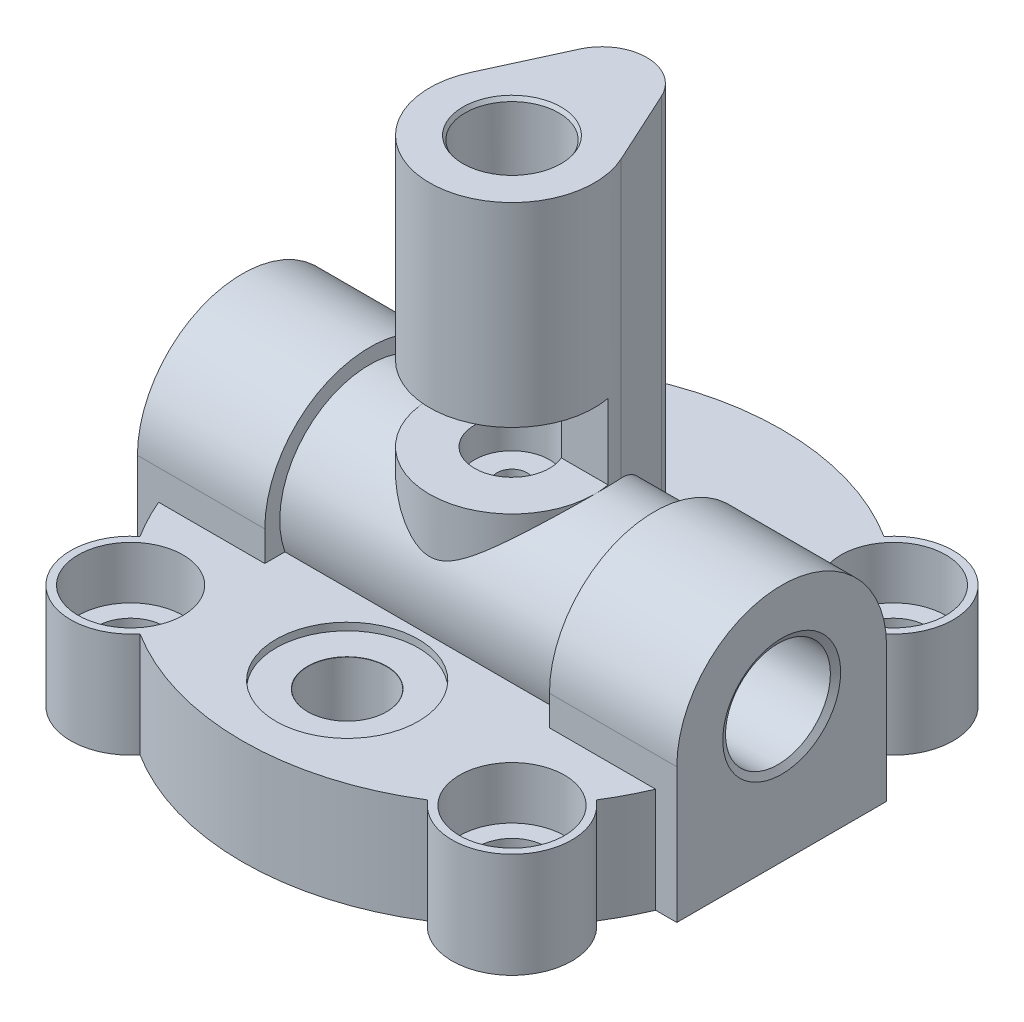
from build123d import *

# Parameters (mm, degrees)
SKETCH_1_R                      = 36
EXTRUDE_1_DEPTH                 = 14
SKETCH_4_R                      = 12
EXTRUDE_2_DEPTH                 = 36
EXTRUDE_START                   = 36
SKETCH_2_W                      = 28
SKETCH_2_H                      = 18
EXTRUDE_3_DEPTH                 = 17
EXTRUDE_4_DEPTH                 = 66
SKETCH_6_R                      = 8
EXTRUDE_5_DEPTH                 = 14
SKETCH_7_R                      = 30
CUT_EXTRUDE_1_DEPTH             = 4
SKETCH_8_R                      = 7
SKETCH_8_R_2                    = 4.5
CUT_EXTRUDE_2_DEPTH             = 7
SKETCH_8_2_R                    = 4.5
CUT_EXTRUDE_3_DEPTH             = 73.773621666
PATTERN_CIRCULAR_1_COUNT        = 4
SKETCH_9_R                      = 9.5
CUT_EXTRUDE_4_DEPTH             = 1
M12X1_25_1_D                    = 10.5
M12X1_25_1_CSINK_D              = 10.55
M12X1_25_1_CSINK_ANGLE          = 90
SKETCH_14_W                     = 22
SKETCH_14_H                     = 4.5
CHAMFER_1_SIZE                  = 1
CHAMFER_1_SIZE_2                = 0.5
M14X1_5_1_D                     = 12.5
M14X1_5_1_DEPTH                 = 23
M14X1_5_1_CSINK_D               = 12.55
M14X1_5_1_CSINK_ANGLE           = 90
SKETCH_18_R                     = 5
CUT_EXTRUDE_5_DEPTH             = 40
CUT_EXTRUDE_6_REACH             = 85.355
SKETCH_19_W                     = 39.023564767
SKETCH_19_H                     = 10
CUT_EXTRUDE_6_DIRECTION_2_REACH = 85.355
CUT_EXTRUDE_7_REACH             = 66.746
CUT_EXTRUDE_7_END_RADIUS        = 4.5
SKETCH_20_R                     = 2
CUT_EXTRUDE_8_REACH             = 85.355
SKETCH_21_R                     = 2
HOLE_WIZARD_M8_1_D              = 4
HOLE_WIZARD_M8_1_DEPTH          = 56
HOLE_WIZARD_M8_1_TIP            = 1.201721238
CHAMFER_7_SIZE                  = 1
CHAMFER_7_SIZE_2                = 0.5


with BuildPart() as part:
    # 草图1 → 凸台-拉伸1 (new body)
    with BuildSketch(Plane(origin=(0, 0, 0), x_dir=(1, 0, 0), z_dir=(0, 1, 0))):
        with Locations(Location((0, 0, 0), (0, 0, 270))):
            Circle(SKETCH_1_R)
    extrude(amount=EXTRUDE_1_DEPTH)

    # 草图4 → 凸台-拉伸2 (add, symmetric)
    with BuildSketch(Plane(origin=(0, 0, 0), x_dir=(0, 0, -1), z_dir=(1, 0, 0))):
        with Locations((0, 18)):
            Circle(SKETCH_4_R)
    extrude(amount=EXTRUDE_2_DEPTH, both=True)

    # 草图2 → 凸台-拉伸3 (add)
    with BuildSketch(Plane(origin=(0, 0, 0), x_dir=(0, 0, -1), z_dir=(1, 0, 0)).offset(EXTRUDE_START)):
        with Locations((0, 9)):
            Rectangle(SKETCH_2_W, SKETCH_2_H)
        with BuildLine():
            Line((-14, 18), (14, 18))
            ThreePointArc((14, 18), (0, 32), (-14, 18))
        make_face()
    extrude_3 = extrude(amount=-EXTRUDE_3_DEPTH)

    # 镜向1: 凸台-拉伸3 across plane
    add(extrude_3.mirror(Plane(origin=(0, 0, 0), x_dir=(0, 0, 1), z_dir=(1, 0, 0))))

    # 草图5 → 凸台-拉伸4 (add)
    with BuildSketch(Plane(origin=(0, 0, 0), x_dir=(1, 0, 0), z_dir=(0, 1, 0))):
        with BuildLine():
            Line((5.454356057, 14.5), (9.999652772, 4.583333333))
            ThreePointArc((9.999652772, 4.583333333), (0, -11), (-9.999652772, 4.583333333))
            Line((-9.999652772, 4.583333333), (-5.454356057, 14.5))
            ThreePointArc((-5.454356057, 14.5), (0, 18), (5.454356057, 14.5))
        make_face()
    extrude(amount=EXTRUDE_4_DEPTH)

    # 草图6 → 凸台-拉伸5 (add)
    with BuildSketch(Plane(origin=(0, 0, 0), x_dir=(1, 0, 0), z_dir=(0, 1, 0))):
        with Locations((25.455844123, 25.455844123)):
            Circle(SKETCH_6_R)
        with Locations((-25.455844123, 25.455844123)):
            Circle(SKETCH_6_R)
        with Locations((-25.455844123, -25.455844123)):
            Circle(SKETCH_6_R)
        with Locations((25.455844123, -25.455844123)):
            Circle(SKETCH_6_R)
    extrude(amount=EXTRUDE_5_DEPTH)

    # 草图7 → 切除-拉伸1 (cut)
    with BuildSketch(Plane.XZ):
        with Locations(Location((0, 0, 0), (0, 0, 270))):
            Circle(SKETCH_7_R)
    extrude(amount=-CUT_EXTRUDE_1_DEPTH, mode=Mode.SUBTRACT)

    # 草图8 → 切除-拉伸2 (cut)
    with BuildSketch(Plane(origin=(0, 14, 0), x_dir=(1, 0, 0), z_dir=(0, 1, 0))):
        with Locations(Location((-25.455844123, 25.455844123, 0), (0, 0, 270))):
            Circle(SKETCH_8_R)
        with Locations(Location((-25.455844123, 25.455844123, 0), (0, 0, 270))):
            Circle(SKETCH_8_R_2, mode=Mode.SUBTRACT)
    cut_extrude_2 = extrude(amount=-CUT_EXTRUDE_2_DEPTH, mode=Mode.SUBTRACT)

    # 草图8<2> → 切除-拉伸3 (cut, through all)
    with BuildSketch(Plane(origin=(0, 14, 0), x_dir=(1, 0, 0), z_dir=(0, 1, 0))):
        with Locations(Location((-25.455844123, 25.455844123, 0), (0, 0, 270))):
            Circle(SKETCH_8_2_R)
    cut_extrude_3 = extrude(amount=-CUT_EXTRUDE_3_DEPTH, mode=Mode.SUBTRACT)

    # 阵列(圆周)1: 切除-拉伸2, 切除-拉伸3 ×4 about axis
    pattern_circular_1_axis = Axis((0, 0, 0), (0, 1, 0))
    add([cut_extrude_2.rotate(pattern_circular_1_axis, i * 360 / PATTERN_CIRCULAR_1_COUNT) for i in range(1, PATTERN_CIRCULAR_1_COUNT)], mode=Mode.SUBTRACT)
    add([cut_extrude_3.rotate(pattern_circular_1_axis, i * 360 / PATTERN_CIRCULAR_1_COUNT) for i in range(1, PATTERN_CIRCULAR_1_COUNT)], mode=Mode.SUBTRACT)

    # 草图9 → 切除-拉伸4 (cut)
    with BuildSketch(Plane(origin=(0, 14, 0), x_dir=(1, 0, 0), z_dir=(0, 1, 0))):
        with Locations(Location((0, -22, 0), (0, 0, 270))):
            Circle(SKETCH_9_R)
    extrude(amount=-CUT_EXTRUDE_4_DEPTH, mode=Mode.SUBTRACT)

    # M12X1.25 螺纹孔的螺纹孔钻头1 (through all)
    with Locations(Plane(origin=(0, 13, 0), x_dir=(1, 0, 0), z_dir=(0, 1, 0))):
        with Locations((0, -22)):
            CounterSinkHole(M12X1_25_1_D / 2, M12X1_25_1_CSINK_D / 2, counter_sink_angle=M12X1_25_1_CSINK_ANGLE)

    # 草图14 → 切除-旋转2 (revolve, cut)
    with BuildSketch(Plane.XY, mode=Mode.PRIVATE) as cut_revolve_2_sk:
        Polygon((-36, 25), (-36, 18), (-20, 18), (-20, 24), (-20, 25), align=None)
        Polygon((-20, 24), (-20, 18), (-11, 18), (-11, 22.5), (-11, 24), align=None)
        with Locations((0, 20.25)):
            Rectangle(SKETCH_14_W, SKETCH_14_H)
        Polygon((11, 22.5), (11, 18), (20, 18), (20, 24), (11, 24), align=None)
        Polygon((20, 24), (20, 18), (36, 18), (36, 25), (20, 25), align=None)
    revolve(cut_revolve_2_sk.sketch.rotate(Axis((-36, 18, 0), (1, 0, 0)), 90), axis=Axis((-36, 18, 0), (1, 0, 0)), mode=Mode.SUBTRACT)

    # 倒角1
    # the kernel refuses this chamfer: 1, 0.5 mm, written as the material it takes off along each edge
    with BuildSketch(Plane(origin=(-36, 18, 0), x_dir=(0, -1, 0), z_dir=(0, 0, 1))) as chamfer_1_piece_1:
        Polygon((7 + CHAMFER_1_SIZE, 0), (7, CHAMFER_1_SIZE_2), (7, 0), align=None)
    revolve(axis=Axis((-36, 18, 0), (1, 0, 0)), revolution_arc=270, mode=Mode.SUBTRACT)
    with BuildSketch(Plane(origin=(-36, 18, 0), x_dir=(0, 0, 1), z_dir=(0, 1, 0))) as chamfer_1_piece_2:
        Polygon((7 + CHAMFER_1_SIZE, 0), (7, CHAMFER_1_SIZE_2), (7, 0), align=None)
    revolve(axis=Axis((-36, 18, 0), (1, 0, 0)), revolution_arc=90, mode=Mode.SUBTRACT)

    # M14X1.5 螺纹孔的螺纹孔钻头1
    with Locations(Plane(origin=(0, 66, 0), x_dir=(1, 0, 0), z_dir=(0, 1, 0))):
        with Locations((0, 0)):
            CounterSinkHole(M14X1_5_1_D / 2, M14X1_5_1_CSINK_D / 2, depth=M14X1_5_1_DEPTH, counter_sink_angle=M14X1_5_1_CSINK_ANGLE)

    # 草图18 → 切除-拉伸5 (cut)
    with BuildSketch(Plane(origin=(0, 66, 0), x_dir=(1, 0, 0), z_dir=(0, 1, 0))):
        with Locations(Location((0, 0, 0), (0, 0, 270))):
            Circle(SKETCH_18_R)
    extrude(amount=-CUT_EXTRUDE_5_DEPTH, mode=Mode.SUBTRACT)

    # 草图19 → 切除-拉伸6 (cut, up to next)
    with BuildSketch(Plane(origin=(0, 0, 0), x_dir=(0, 0, -1), z_dir=(1, 0, 0)), mode=Mode.PRIVATE) as cut_extrude_6_sk1:
        with Locations((-17.511782384, 35)):
            Rectangle(SKETCH_19_W, SKETCH_19_H)
    cut_extrude_6_tool1 = extrude(cut_extrude_6_sk1.sketch, amount=-CUT_EXTRUDE_6_REACH, mode=Mode.PRIVATE) & part.part
    add(cut_extrude_6_tool1.solids().sort_by_distance((0, 35, 17.511782))[0], mode=Mode.SUBTRACT)

    # 草图19 → 切除-拉伸6 direction 2 (cut, up to next)
    with BuildSketch(Plane(origin=(0, 0, 0), x_dir=(0, 0, -1), z_dir=(1, 0, 0)), mode=Mode.PRIVATE) as cut_extrude_6_direction_2_sk1:
        with Locations((-17.511782384, 35)):
            Rectangle(SKETCH_19_W, SKETCH_19_H)
    cut_extrude_6_direction_2_tool1 = extrude(cut_extrude_6_direction_2_sk1.sketch, amount=CUT_EXTRUDE_6_DIRECTION_2_REACH, mode=Mode.PRIVATE) & part.part
    add(cut_extrude_6_direction_2_tool1.solids().sort_by_distance((0, 35, 17.511782))[0], mode=Mode.SUBTRACT)

    # 切除-拉伸7: up to this cylinder (the profile starts outside it)
    cut_extrude_7_end = Plane(origin=(0, 18, 0), z_dir=(-1, 0, 0)) * Cylinder(CUT_EXTRUDE_7_END_RADIUS, 143.492, mode=Mode.PRIVATE)
    # 草图20 → 切除-拉伸7 (cut, up to the surface)
    with BuildSketch(Plane(origin=(0, 26, 0), x_dir=(1, 0, 0), z_dir=(0, 1, 0)), mode=Mode.PRIVATE) as cut_extrude_7_sk1:
        with Locations(Location((0, 0, 0), (0, 0, 270))):
            Circle(SKETCH_20_R)
    cut_extrude_7_tool1 = extrude(cut_extrude_7_sk1.sketch, amount=-CUT_EXTRUDE_7_REACH, mode=Mode.PRIVATE) - cut_extrude_7_end
    add(cut_extrude_7_tool1.solids().sort_by_distance((0, 26, 0))[0], mode=Mode.SUBTRACT)

    # 草图21 → 切除-拉伸8 (cut, up to next)
    with BuildSketch(Plane.XY, mode=Mode.PRIVATE) as cut_extrude_8_sk1:
        with Locations((0, 56)):
            Circle(SKETCH_21_R)
    cut_extrude_8_tool1 = extrude(cut_extrude_8_sk1.sketch, amount=-CUT_EXTRUDE_8_REACH, mode=Mode.PRIVATE) & part.part
    add(cut_extrude_8_tool1.solids().sort_by_distance((0, 56, 0))[0], mode=Mode.SUBTRACT)

    # M8 螺纹孔的螺纹孔钻头1
    with Locations(Plane(origin=(0, 4, 0), x_dir=(-1, 0, 0), z_dir=(0, -1, 0))):
        with Locations((0, 12)):
            Hole(HOLE_WIZARD_M8_1_D / 2, depth=HOLE_WIZARD_M8_1_DEPTH)
            with Locations((0, 0, -(HOLE_WIZARD_M8_1_DEPTH + HOLE_WIZARD_M8_1_TIP / 2))):  # 118° drill point
                Cone(0, HOLE_WIZARD_M8_1_D / 2, HOLE_WIZARD_M8_1_TIP, mode=Mode.SUBTRACT)

    # 倒角7
    # the kernel refuses this chamfer: 1, 0.5 mm, written as the material it takes off along each edge
    with BuildSketch(Plane(origin=(0, 65.975, 0), x_dir=(-1, 0, 0), z_dir=(0, 0, 1))) as chamfer_7_piece_1:
        Polygon((6.25 + CHAMFER_7_SIZE * 0.707106781187, -CHAMFER_7_SIZE * 0.707106781187), (6.25, CHAMFER_7_SIZE_2), (6.25, 0), align=None)
    revolve(axis=Axis((0, 65.975, 0), (0, -1, 0)), mode=Mode.SUBTRACT)

    # 倒角8: read off the stored shape, not the designer's step
    # 倒角8 outline → 倒角8 (revolve, cut)
    with BuildSketch(Plane(origin=(0, 18, 0), x_dir=(0, 1, 0), z_dir=(0, 0, -1))):
        Polygon((7, 36), (7, 35.5), (7.866025404, 36), align=None)
    revolve(axis=Axis((0, 18, 0), (1, 0, 0)), mode=Mode.SUBTRACT)

    # 倒角9: read off the stored shape, not the designer's step
    # 倒角9 outline → 倒角9 (revolve, cut)
    with BuildSketch(Plane(origin=(0, 18, 0), x_dir=(0, 1, 0), z_dir=(0, 0, -1))):
        Polygon((5.366025404, -11), (4.5, -10.5), (4.5, -11), align=None)
        Polygon((6.866025404, -20), (6, -19.5), (6, -20), align=None)
    revolve(axis=Axis((0, 18, 0), (1, 0, 0)), mode=Mode.SUBTRACT)

    # 倒角10: read off the stored shape, not the designer's step
    # 倒角10 outline → 倒角10 (revolve, cut)
    with BuildSketch(Plane(origin=(0, 18, 0), x_dir=(0, 1, 0), z_dir=(0, 0, -1))):
        Polygon((6, 20), (6, 19.5), (6.866025404, 20), align=None)
        Polygon((4.5, 10.5), (5.366025404, 11), (4.5, 11), align=None)
    revolve(axis=Axis((0, 18, 0), (1, 0, 0)), mode=Mode.SUBTRACT)

    # 草图24 → 切除-旋转3 (revolve, cut)
    with BuildSketch(Plane.XY):
        Polygon((16.768802425, 14.192263388), (0, -14.852154395), (-0.866025404, -14.352154395), (15.902777021, 14.692263388), align=None)
    revolve(axis=Axis((16.768802425, 14.192263388, 0), (-0.5000000000000009, -0.8660254037844382, 0)), mode=Mode.SUBTRACT)


solid = part.part
